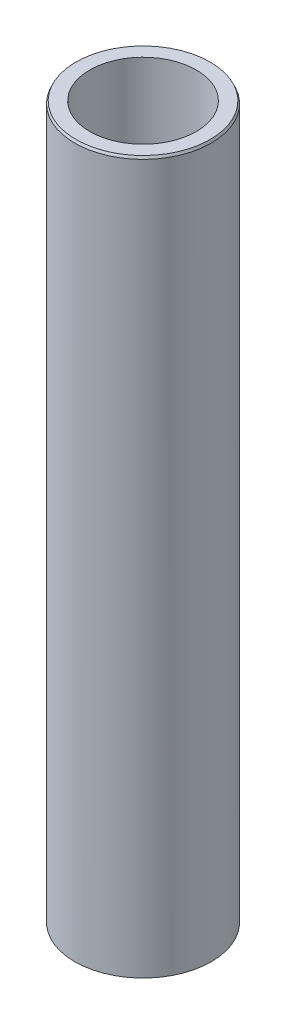
from build123d import *
from OCP.BRepFilletAPI import BRepFilletAPI_MakeChamfer

# Parameters (mm, degrees)
SKETCH1_R           = 57.5
BOSS_EXTRUDE1_DEPTH = 600
SKETCH2_R           = 44.892530007
CUT_EXTRUDE1_DEPTH  = 606.485342515
CHAMFER1_SIZE       = 2.13308057
CHAMFER1_SIZE2      = 1.001712425


with BuildPart() as part:
    # Sketch1 → Boss-Extrude1 (new body)
    with BuildSketch(Plane(origin=(0, 0, 0), x_dir=(1, 0, 0), z_dir=(0, 1, 0))):
        Circle(SKETCH1_R)
    extrude(amount=BOSS_EXTRUDE1_DEPTH)

    # Sketch2 → Cut-Extrude1 (cut, through all)
    with BuildSketch(Plane(origin=(0, 0, 0), x_dir=(1, 0, 0), z_dir=(0, 1, 0))):
        Circle(SKETCH2_R)
    extrude(amount=CUT_EXTRUDE1_DEPTH, mode=Mode.SUBTRACT)

    # Chamfer1: one chamfer whose edges measure the first distance from different faces: ONE call of the kernel's chamfer builder (chamfer() names one face for all edges)
    chamfer1_edges_1 = [part.edges().sort_by_distance(p)[0] for p in [
        (-57.5, 600, 0),
    ]]
    chamfer1_side_1 = [part.faces().sort_by_distance(p)[0] for p in [
        (-57.5, 300, 0),
    ]]
    chamfer1_edges_2 = [part.edges().sort_by_distance(p)[0] for p in [
        (-57.5, 0, 0),
    ]]
    chamfer1_side_2 = [part.faces().sort_by_distance(p)[0] for p in [
        (-55.873654403, 0, 0),
    ]]
    chamfer1 = BRepFilletAPI_MakeChamfer(part.part.solid().wrapped)
    for e in chamfer1_edges_1:
        chamfer1.Add(CHAMFER1_SIZE, CHAMFER1_SIZE2, e.wrapped, chamfer1_side_1[0].wrapped)  # the first distance lies on this face
    for e in chamfer1_edges_2:
        chamfer1.Add(CHAMFER1_SIZE, CHAMFER1_SIZE2, e.wrapped, chamfer1_side_2[0].wrapped)  # the first distance lies on this face
    add(Compound.cast(chamfer1.Shape()), mode=Mode.REPLACE)


solid = part.part
